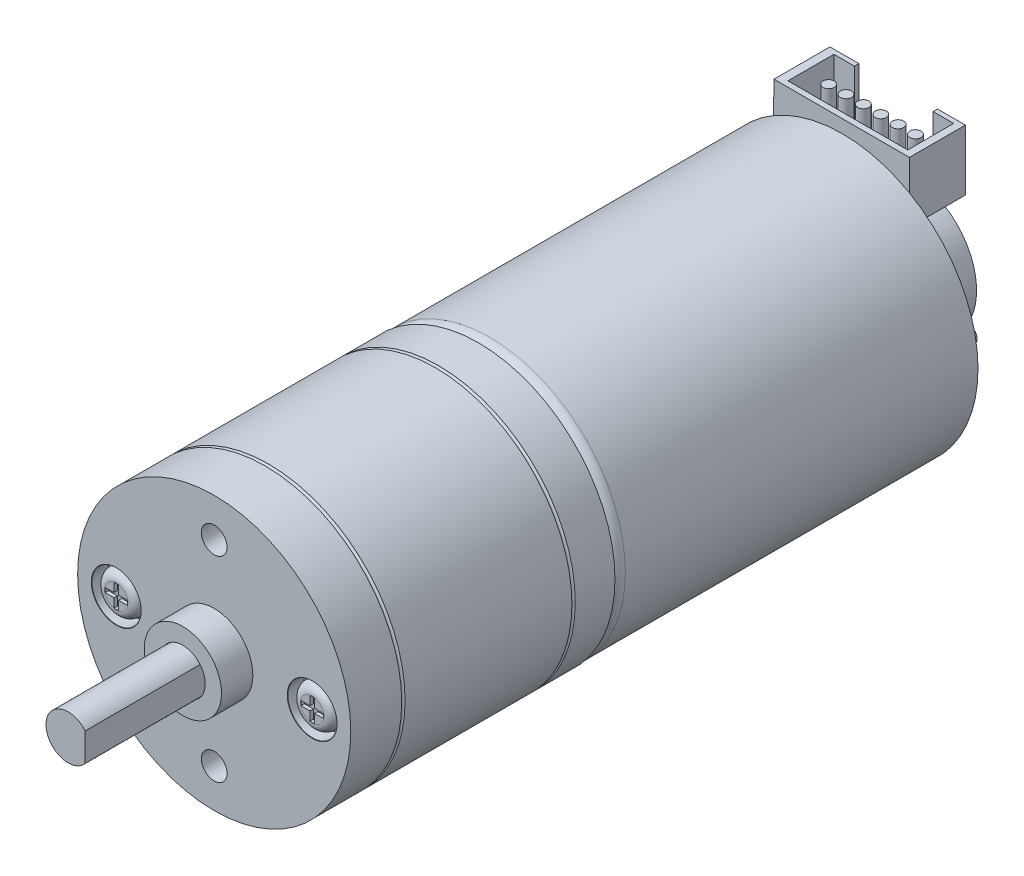
from build123d import *

# Parameters (mm, degrees)
SKETCH1_R                                  = 12.125
BOSS_EXTRUDE1_DEPTH                        = 31
FILLET2_R                                  = 1
SHELL1_START                               = 1
SHELL1_OUTLINE_R                           = 11.125
SHELL1_DEPTH                               = 30
SKETCH11_R                                 = 12.2
BOSS_EXTRUDE4_DEPTH                        = 23.6
SKETCH12_R                                 = 3.45
SKETCH12_R_2                               = 2
BOSS_EXTRUDE5_DEPTH                        = 2.8
SKETCH14_R                                 = 1.975
BOSS_EXTRUDE6_DEPTH                        = 13.05
CUT_EXTRUDE5_DEPTH                         = 13.05
SKETCH17_R                                 = 0.15
SKETCH18_R                                 = 1.15
CUT_EXTRUDE7_DEPTH                         = 10
CBORE_FOR_M2_CHEESE_HEAD_SCREW1_AT_2_COUNT = 2
CBORE_FOR_M2_CHEESE_HEAD_SCREW1_AT_2_PITCH = 17.5
SKETCH24_R                                 = 1.842235559
BOSS_EXTRUDE7_DEPTH                        = 1.4
CUT_EXTRUDE9_DEPTH                         = 0.3
FILLET3_R                                  = 0.8
FILLET3_OF_MIRROR2_R                       = 0.8
BOSS_EXTRUDE8_START                        = 1.5
SKETCH26_R                                 = 12.125
BOSS_EXTRUDE8_DEPTH                        = 1.5
BOSS_EXTRUDE9_START                        = 1
SKETCH27_R                                 = 6
BOSS_EXTRUDE9_DEPTH                        = 5
SKETCH28_R                                 = 0.75
BOSS_EXTRUDE10_DEPTH                       = 8
BOSS_EXTRUDE11_DEPTH                       = 5
SKETCH31_W                                 = 7.02358916
SKETCH31_H                                 = 2.353363912
SKETCH31_H_2                               = 0.39838489
CUT_EXTRUDE10_DEPTH                        = 4.5
SKETCH32_R                                 = 0.5
BOSS_EXTRUDE12_DEPTH                       = 4
BOSS_EXTRUDE13_DEPTH                       = 4
SKETCH33_4_W                               = 2.145707953
SKETCH33_4_H                               = 1.092403472
SKETCH33_4_W_2                             = 0.820417747
SKETCH33_4_H_2                             = 2.019489838
BOSS_EXTRUDE14_DEPTH                       = 1


# Read off the part's stored shape, not the designer's step: Shell1
with BuildPart() as part:
    # Sketch1 → Boss-Extrude1 (new body)
    with BuildSketch(Plane.XY):
        Circle(SKETCH1_R)
    extrude(amount=BOSS_EXTRUDE1_DEPTH)

    # Fillet2
    fillet2_edges = [part.edges().sort_by_distance(p)[0] for p in [
        (-12.125, 0, 31),
    ]]
    fillet(fillet2_edges, radius=FILLET2_R)

    # Shell1 outline → Shell1 (cut)
    with BuildSketch(Plane.XY.offset(SHELL1_START)):
        Circle(SHELL1_OUTLINE_R)
    extrude(amount=SHELL1_DEPTH, mode=Mode.SUBTRACT)

    # Sketch26 → Boss-Extrude8 (add)
    with BuildSketch(Plane(origin=(0, 0, 0), x_dir=(-1, 0, 0), z_dir=(0, 0, -1)).offset(BOSS_EXTRUDE8_START)):
        Circle(SKETCH26_R)
    extrude(amount=-BOSS_EXTRUDE8_DEPTH)



with BuildPart() as body_2:
    # Sketch11 → Boss-Extrude4 (new body)
    with BuildSketch(Plane.XY.offset(31)):
        Circle(SKETCH11_R)
    extrude(amount=BOSS_EXTRUDE4_DEPTH)

    # Sketch12 → Boss-Extrude5 (add)
    with BuildSketch(Plane.XY.offset(54.6)):
        Circle(SKETCH12_R)
        Circle(SKETCH12_R_2, mode=Mode.SUBTRACT)
    extrude(amount=BOSS_EXTRUDE5_DEPTH)

    # Sketch14 → Boss-Extrude6 (add)
    with BuildSketch(Plane.XY.offset(54.6)):
        Circle(SKETCH14_R)
    extrude(amount=BOSS_EXTRUDE6_DEPTH)

    # Sketch16 → Cut-Extrude5 (cut)
    with BuildSketch(Plane.XY.offset(67.65)):
        with BuildLine():
            Line((1.525, 0), (1.525, 1.25499004))
            ThreePointArc((1.525, 1.25499004), (1.975, 0), (1.525, -1.25499004))
            Line((1.525, -1.25499004), (1.525, 0))
        make_face()
    extrude(amount=-CUT_EXTRUDE5_DEPTH, mode=Mode.SUBTRACT)

    # Sketch17 → Cut-Revolve1 (revolve, cut)
    with BuildSketch(Plane(origin=(0, 0, 0), x_dir=(1, 0, 0), z_dir=(0, 1, 0))):
        with Locations((-12.2, -49.9)):
            Circle(SKETCH17_R)
        with Locations((-12.2, -34.7)):
            Circle(SKETCH17_R)
    revolve(axis=Axis((0, 0, 54.6), (0, 0, -1)), mode=Mode.SUBTRACT)

    # Sketch18 → Cut-Extrude7 (cut)
    with BuildSketch(Plane.XY.offset(54.6)):
        with Locations((0, 8.75)):
            Circle(SKETCH18_R)
        with Locations(Location((0, -8.75, 0), (0, 0, 180))):
            Circle(SKETCH18_R)
    extrude(amount=-CUT_EXTRUDE7_DEPTH, mode=Mode.SUBTRACT)

    # Sketch23 → CBORE for M2 Cheese Head Screw1 (revolve, cut)
    with BuildSketch(Plane(origin=(-8.75, 0, 54.6), x_dir=(0, -1, 0), z_dir=(1, 0, 0))):
        Polygon((0, 0), (0, 5.781118805), (1.3, 5), (1.3, 1.4), (2.2, 1.4), (2.2, 0.025), (2.225, 0), align=None)
    cbore_for_m2_cheese_head_screw1 = revolve(axis=Axis((-8.75, 0, 60.95), (0, 0, -1)), mode=Mode.SUBTRACT)

    # CBORE for M2 Cheese Head Screw1 at 2: CBORE for M2 Cheese Head Screw1 ×2
    with Locations(*[(i * CBORE_FOR_M2_CHEESE_HEAD_SCREW1_AT_2_PITCH, 0, 0) for i in range(1, CBORE_FOR_M2_CHEESE_HEAD_SCREW1_AT_2_COUNT)]):
        add(cbore_for_m2_cheese_head_screw1, mode=Mode.SUBTRACT)

    # Sketch24 → Boss-Extrude7 (add)
    with BuildSketch(Plane.XY.offset(53.2)):
        with Locations(Location((-8.75, 0, 0), (0, 0, 180))):
            Circle(SKETCH24_R)
    boss_extrude7 = extrude(amount=BOSS_EXTRUDE7_DEPTH)

    # Sketch25 → Cut-Extrude9 (cut)
    with BuildSketch(Plane.XY.offset(54.6)):
        Polygon((-8.55, 0.2), (-7.75, 0.2), (-7.75, -0.2), (-8.55, -0.2), (-8.55, -1), (-8.95, -1), (-8.95, -0.2), (-9.75, -0.2), (-9.75, 0.2), (-8.95, 0.2), (-8.95, 1), (-8.55, 1), align=None)
    cut_extrude9 = extrude(amount=-CUT_EXTRUDE9_DEPTH, mode=Mode.SUBTRACT)

    # Fillet3
    fillet3_edges = [body_2.edges().sort_by_distance(p)[0] for p in [
        (-6.907764441, 0, 54.6),
    ]]
    fillet(fillet3_edges, radius=FILLET3_R)

    # Mirror2: Boss-Extrude7, Cut-Extrude9 across plane
    add(boss_extrude7.mirror(Plane(origin=(0, 0, 0), x_dir=(0, 0, 1), z_dir=(1, 0, 0))))
    add(cut_extrude9.mirror(Plane(origin=(0, 0, 0), x_dir=(0, 0, 1), z_dir=(1, 0, 0))), mode=Mode.SUBTRACT)

    # Fillet3 of Mirror2
    fillet3_of_mirror2_edges = [body_2.edges().sort_by_distance(p)[0] for p in [
        (6.907764441, 0, 54.6),
    ]]
    fillet(fillet3_of_mirror2_edges, radius=FILLET3_OF_MIRROR2_R)


with BuildPart() as body_3:
    # Sketch27 → Boss-Extrude9 (new body)
    with BuildSketch(Plane(origin=(0, 0, -1.5), x_dir=(-1, 0, 0), z_dir=(0, 0, -1)).offset(BOSS_EXTRUDE9_START)):
        Circle(SKETCH27_R)
    extrude(amount=BOSS_EXTRUDE9_DEPTH)


with BuildPart() as part_1:
    add(part.part)

    add(body_3.part)  # Boss-Extrude10 merges body 3
    # Sketch28 → Boss-Extrude10 (add)
    with BuildSketch(Plane(origin=(0, 0, -1.5), x_dir=(-1, 0, 0), z_dir=(0, 0, -1))):
        Circle(SKETCH28_R)
    extrude(amount=BOSS_EXTRUDE10_DEPTH)

    # Sketch29 → Boss-Extrude11 (add)
    with BuildSketch(Plane(origin=(0, 0, -1.5), x_dir=(-1, 0, 0), z_dir=(0, 0, -1))):
        Polygon((6.099445351, 13.287426403), (-6, 13.287426403), (-6, 7.871973463), (6.178591018, 7.871973463), align=None)
    extrude(amount=BOSS_EXTRUDE11_DEPTH)

    # Sketch31 → Cut-Extrude10 (cut)
    with BuildSketch(Plane(origin=(0, 13.287426403, 0), x_dir=(1, 0, 0), z_dir=(0, 1, 0))):
        Polygon((5.348948358, 1.998835879), (5.348948358, 6.10161511), (3.51179458, 6.10161511), (3.51179458, 3.748251198), (-3.51179458, 3.748251198), (-3.51179458, 6.10161511), (-5.348948358, 6.10161511), (-5.348948358, 1.998835879), align=None)
        with Locations((0, 4.924933154)):
            Rectangle(SKETCH31_W, SKETCH31_H)
        with Locations((0, 6.300807555)):
            Rectangle(SKETCH31_W, SKETCH31_H_2)
    extrude(amount=-CUT_EXTRUDE10_DEPTH, mode=Mode.SUBTRACT)

    # Sketch32 → Boss-Extrude12 (add)
    with BuildSketch(Plane(origin=(0, 8.787426403, 0), x_dir=(1, 0, 0), z_dir=(0, 1, 0))):
        with Locations(Location((3.980307899, 4.055615649, 0), (0, 0, 180))):
            Circle(SKETCH32_R)
        with Locations(Location((2.430307899, 4.055615649, 0), (0, 0, 180))):
            Circle(SKETCH32_R)
        with Locations(Location((0.880307899, 4.055615649, 0), (0, 0, 180))):
            Circle(SKETCH32_R)
        with Locations(Location((-0.669692101, 4.055615649, 0), (0, 0, 180))):
            Circle(SKETCH32_R)
        with Locations(Location((-2.219692101, 4.055615649, 0), (0, 0, 180))):
            Circle(SKETCH32_R)
        with Locations(Location((-3.769692101, 4.055615649, 0), (0, 0, 180))):
            Circle(SKETCH32_R)
    extrude(amount=BOSS_EXTRUDE12_DEPTH)

    # Sketch33 → Boss-Extrude13 (add)
    with BuildSketch(Plane(origin=(0, 0, -1.5), x_dir=(-1, 0, 0), z_dir=(0, 0, -1))):
        with BuildLine():
            Line((6.485003155, -4.688937379), (7.887571356, -2.036994234))
            ThreePointArc((7.887571356, -2.036994234), (7.57522762, -1.023366398), (6.561599784, -1.335710134))
            Line((6.561599784, -1.335710134), (5.159031583, -3.987653278))
            ThreePointArc((5.159031583, -3.987653278), (5.471375319, -5.001281114), (6.485003155, -4.688937379))
        make_face()
        with BuildLine():
            ThreePointArc((-6.654317468, -1.338157716), (-7.684851268, -1.087159533), (-7.935849451, -2.117693332))
            Line((-7.935849451, -2.117693332), (-6.376778219, -4.680757298))
            ThreePointArc((-6.376778219, -4.680757298), (-5.34624442, -4.931755482), (-5.095246236, -3.901221682))
            Line((-5.095246236, -3.901221682), (-6.654317468, -1.338157716))
        make_face()
    extrude(amount=BOSS_EXTRUDE13_DEPTH)

    # Sketch33<4> → Boss-Extrude14 (add)
    with BuildSketch(Plane(origin=(0, 0, -1.5), x_dir=(-1, 0, 0), z_dir=(0, 0, -1))):
        with BuildLine():
            Line((5.159031583, -3.987653278), (6.561599784, -1.335710134))
            ThreePointArc((6.561599784, -1.335710134), (7.57522762, -1.023366398), (7.887571356, -2.036994234))
            Line((7.887571356, -2.036994234), (6.485003155, -4.688937379))
            ThreePointArc((6.485003155, -4.688937379), (5.471375319, -5.001281114), (5.159031583, -3.987653278))
        make_face()
        with BuildLine():
            Line((-6.376778219, -4.680757298), (-7.935849451, -2.117693332))
            ThreePointArc((-7.935849451, -2.117693332), (-7.684851268, -1.087159533), (-6.654317468, -1.338157716))
            Line((-6.654317468, -1.338157716), (-5.095246236, -3.901221682))
            ThreePointArc((-5.095246236, -3.901221682), (-5.34624442, -4.931755482), (-6.376778219, -4.680757298))
        make_face()
        with Locations((-9.583787275, 0)):
            Rectangle(SKETCH33_4_W, SKETCH33_4_H)
        with Locations((9.583787275, 0)):
            Rectangle(SKETCH33_4_W, SKETCH33_4_H)
        with Locations((2.168473025, -8.277061273)):
            Rectangle(SKETCH33_4_W_2, SKETCH33_4_H_2)
        with Locations((-2.168473025, -8.277061273)):
            Rectangle(SKETCH33_4_W_2, SKETCH33_4_H_2)
    extrude(amount=BOSS_EXTRUDE14_DEPTH)


solid = Compound([body_2.part, part_1.part])
